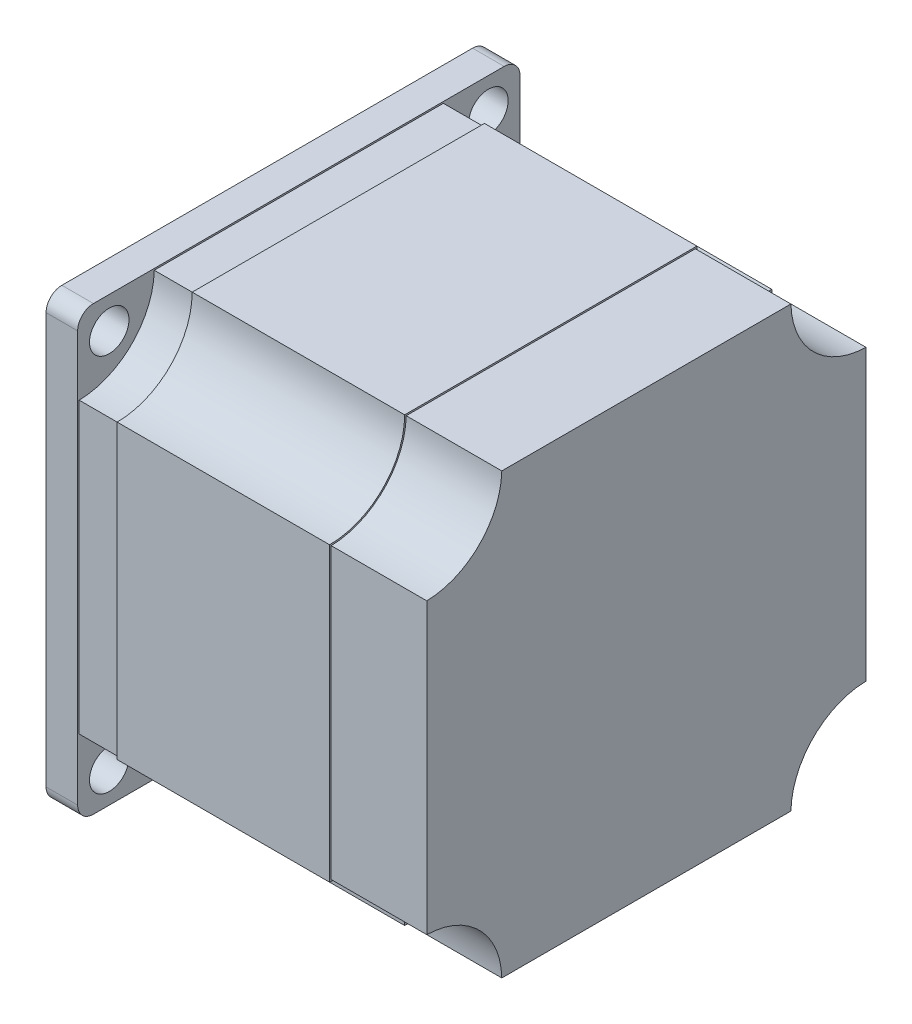
from build123d import *

# Parameters (mm, degrees)
SKETCH1_R           = 3
BOSS_EXTRUDE1_DEPTH = 27
CUT_EXTRUDE4_START  = -0.1
CUT_EXTRUDE4_DEPTH  = 0.1
BOSS_EXTRUDE4_DEPTH = 12
BOSS_EXTRUDE5_START = 5
BOSS_EXTRUDE5_DEPTH = 5
SKETCH14_R          = 2.5
BOSS_EXTRUDE7_DEPTH = 4
SKETCH15_R          = 19
BOSS_EXTRUDE8_DEPTH = 2
SKETCH16_R          = 3
CUT_EXTRUDE6_DEPTH  = 10


with BuildPart() as part:
    # Sketch1 → Boss-Extrude1 (new body)
    with BuildSketch(Plane(origin=(0, 0, 0), x_dir=(0, 0, -1), z_dir=(1, 0, 0))):
        with BuildLine():
            Line((-18.5, 28), (18.5, 28))
            ThreePointArc((18.5, 28), (21.282485579, 21.282485579), (28, 18.5))
            Line((28, 18.5), (28, -18.5))
            ThreePointArc((28, -18.5), (21.282485579, -21.282485579), (18.5, -28))
            Line((18.5, -28), (-18.5, -28))
            ThreePointArc((-18.5, -28), (-21.282485579, -21.282485579), (-28, -18.5))
            Line((-28, -18.5), (-28, 18.5))
            ThreePointArc((-28, 18.5), (-21.282485579, 21.282485579), (-18.5, 28))
        make_face()
        Circle(SKETCH1_R, mode=Mode.SUBTRACT)
    extrude(amount=BOSS_EXTRUDE1_DEPTH)

    # Sketch6 → Cut-Extrude4 (cut)
    with BuildSketch(Plane(origin=(27, 0, 0), x_dir=(0, 0, -1), z_dir=(1, 0, 0)).offset(CUT_EXTRUDE4_START)):
        with BuildLine():
            Line((28, -18.5), (28, 18.5))
            ThreePointArc((28, 18.5), (21.282485579, 21.282485579), (18.5, 28))
            Line((18.5, 28), (-18.5, 28))
            ThreePointArc((-18.5, 28), (-21.282485579, 21.282485579), (-28, 18.5))
            Line((-28, 18.5), (-28, -18.5))
            ThreePointArc((-28, -18.5), (-21.282485579, -21.282485579), (-18.5, -28))
            Line((-18.5, -28), (18.5, -28))
            ThreePointArc((18.5, -28), (21.282485579, -21.282485579), (28, -18.5))
        make_face()
        with BuildLine():
            Line((18.302062075, 27.8), (-18.302062075, 27.8))
            ThreePointArc((-18.302062075, 27.8), (-21.141064222, 21.141064222), (-27.8, 18.302062075))
            Line((-27.8, 18.302062075), (-27.8, -18.302062075))
            ThreePointArc((-27.8, -18.302062075), (-21.141064222, -21.141064222), (-18.302062075, -27.8))
            Line((-18.302062075, -27.8), (18.302062075, -27.8))
            ThreePointArc((18.302062075, -27.8), (21.141064222, -21.141064222), (27.8, -18.302062075))
            Line((27.8, -18.302062075), (27.8, 18.302062075))
            ThreePointArc((27.8, 18.302062075), (21.141064222, 21.141064222), (18.302062075, 27.8))
        make_face(mode=Mode.SUBTRACT)
    extrude(amount=CUT_EXTRUDE4_DEPTH, mode=Mode.SUBTRACT)

    # Sketch10 → Boss-Extrude4 (add)
    with BuildSketch(Plane(origin=(27, 0, 0), x_dir=(0, 0, -1), z_dir=(1, 0, 0))):
        with BuildLine():
            Line((27.8, -18.302062075), (27.8, 18.302062075))
            ThreePointArc((27.8, 18.302062075), (21.141064222, 21.141064222), (18.302062075, 27.8))
            Line((18.302062075, 27.8), (-18.302062075, 27.8))
            ThreePointArc((-18.302062075, 27.8), (-21.141064222, 21.141064222), (-27.8, 18.302062075))
            Line((-27.8, 18.302062075), (-27.8, -18.302062075))
            ThreePointArc((-27.8, -18.302062075), (-21.141064222, -21.141064222), (-18.302062075, -27.8))
            Line((-18.302062075, -27.8), (18.302062075, -27.8))
            ThreePointArc((18.302062075, -27.8), (21.141064222, -21.141064222), (27.8, -18.302062075))
        make_face()
    extrude(amount=BOSS_EXTRUDE4_DEPTH)

    # Sketch12 → Boss-Extrude5 (add)
    with BuildSketch(Plane.ZY.offset(BOSS_EXTRUDE5_START)):
        with BuildLine():
            Line((-27.8, 18.302062075), (-27.8, -18.302062075))
            ThreePointArc((-27.8, -18.302062075), (-21.141064222, -21.141064222), (-18.302062075, -27.8))
            Line((-18.302062075, -27.8), (18.302062075, -27.8))
            ThreePointArc((18.302062075, -27.8), (21.141064222, -21.141064222), (27.8, -18.302062075))
            Line((27.8, -18.302062075), (27.8, 18.302062075))
            ThreePointArc((27.8, 18.302062075), (21.141064222, 21.141064222), (18.302062075, 27.8))
            Line((18.302062075, 27.8), (-18.302062075, 27.8))
            ThreePointArc((-18.302062075, 27.8), (-21.141064222, 21.141064222), (-27.8, 18.302062075))
        make_face()
    extrude(amount=-BOSS_EXTRUDE5_DEPTH)

    # Sketch14 → Boss-Extrude7 (add)
    with BuildSketch(Plane.ZY.offset(5)):
        with BuildLine():
            Line((-26, 28), (26, 28))
            ThreePointArc((26, 28), (27.414213562, 27.414213562), (28, 26))
            Line((28, 26), (28, -26))
            ThreePointArc((28, -26), (27.414213562, -27.414213562), (26, -28))
            Line((26, -28), (-26, -28))
            ThreePointArc((-26, -28), (-27.414213562, -27.414213562), (-28, -26))
            Line((-28, -26), (-28, 26))
            ThreePointArc((-28, 26), (-27.414213562, 27.414213562), (-26, 28))
        make_face()
        with Locations((-24, 24)):
            Circle(SKETCH14_R, mode=Mode.SUBTRACT)
        with Locations((24, 24)):
            Circle(SKETCH14_R, mode=Mode.SUBTRACT)
        with Locations((24, -24)):
            Circle(SKETCH14_R, mode=Mode.SUBTRACT)
        with Locations((-24, -24)):
            Circle(SKETCH14_R, mode=Mode.SUBTRACT)
    extrude(amount=BOSS_EXTRUDE7_DEPTH)

    # Sketch15 → Boss-Extrude8 (add)
    with BuildSketch(Plane.ZY.offset(9)):
        Circle(SKETCH15_R)
    extrude(amount=BOSS_EXTRUDE8_DEPTH)

    # Sketch16 → Cut-Extrude6 (cut)
    with BuildSketch(Plane.ZY.offset(11)):
        Circle(SKETCH16_R)
    extrude(amount=-CUT_EXTRUDE6_DEPTH, mode=Mode.SUBTRACT)


solid = part.part
